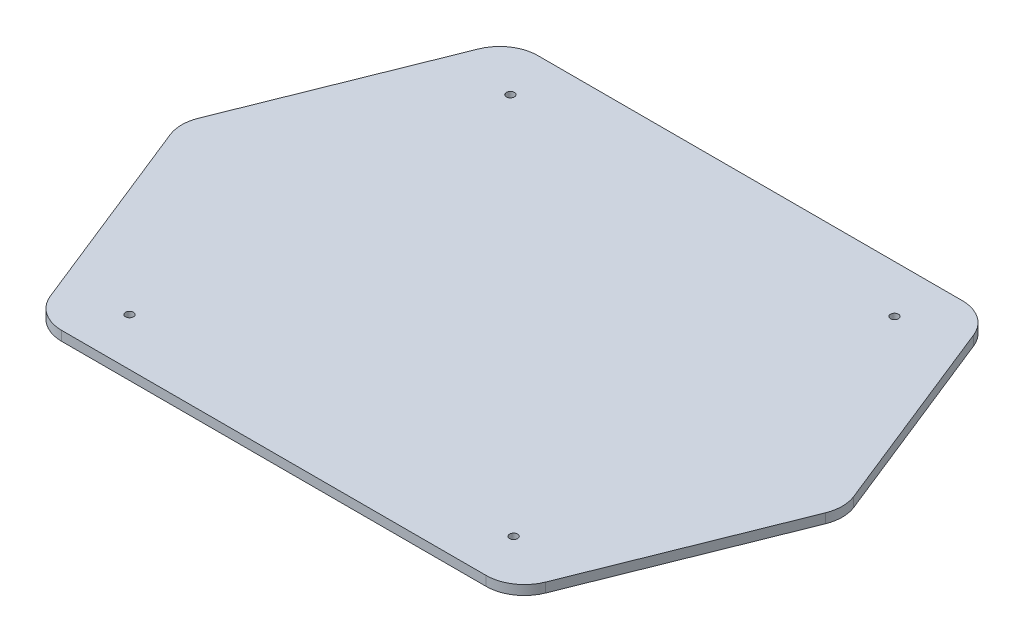
from build123d import *

# Parameters (mm, degrees)
BOSS_EXTRUDE1_DEPTH = 5
FILLET1_R           = 20
SKETCH2_R           = 2.1
RF_HOLE_DEPTH       = 214.864777139


with BuildPart() as part:
    # Sketch1 → Boss-Extrude1 (new body)
    with BuildSketch(Plane(origin=(0, 0, 0), x_dir=(1, 0, 0), z_dir=(0, 1, 0))):
        Polygon((-125, -125), (125, -125), (175, 0), (125, 125), (-125, 125), (-175, 0), align=None)
    extrude(amount=BOSS_EXTRUDE1_DEPTH)

    # Fillet1
    fillet1_edges = [part.edges().sort_by_distance(p)[0] for p in [
        (-125, 2.5, 125),
        (125, 2.5, 125),
        (175, 2.5, 0),
        (125, 2.5, -125),
        (-125, 2.5, -125),
        (-175, 2.5, 0),
    ]]
    fillet(fillet1_edges, radius=FILLET1_R)

    # Sketch2 → RF-Hole (cut, through all)
    with BuildSketch(Plane(origin=(0, 5, 0), x_dir=(1, 0, 0), z_dir=(0, 1, 0))):
        with Locations((-100.857864376, 100)):
            Circle(SKETCH2_R)
        with Locations((100.857864376, 100)):
            Circle(SKETCH2_R)
        with Locations((-100.857864376, -100)):
            Circle(SKETCH2_R)
        with Locations((100.857864376, -100)):
            Circle(SKETCH2_R)
    extrude(amount=-RF_HOLE_DEPTH, mode=Mode.SUBTRACT)


solid = part.part
